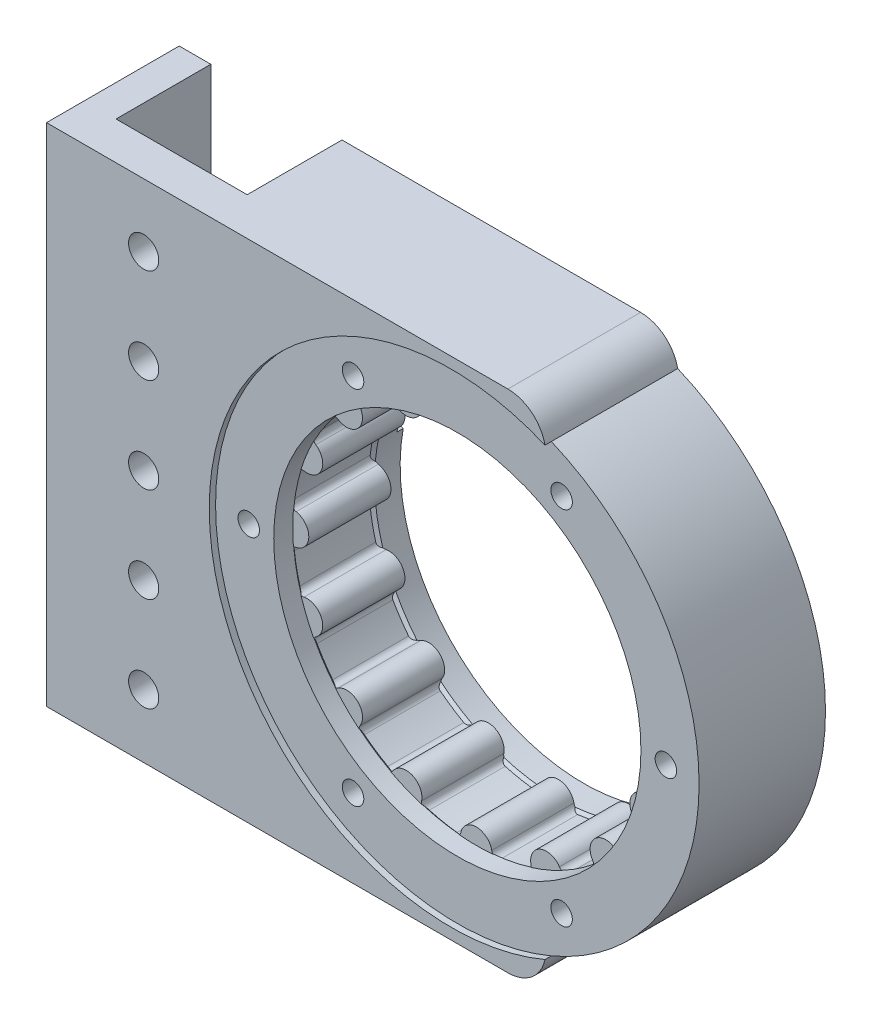
from build123d import *

# Parameters (mm, degrees)
EXTRUDE_START         = -19
EXTRUDE_2_OUTLINE_R   = 35
EXTRUDE_2_OUTLINE_R_2 = 1.7
EXTRUDE_2_DEPTH       = 20
EXTRUDE_START_2       = -16
EXTRUDE_2_2_DEPTH     = 13
EXTRUDE_START_3       = -3.0500001
EXTRUDE_2_3_DEPTH     = 4.0500001
EXTRUDE_2_4_DEPTH     = 3.049996921
EXTRUDE_2_5_DEPTH     = 3.0500001
SKETCH_8_R            = 38.25
SKETCH_8_R_2          = 30
EXTRUDE_3_DEPTH       = 20
EXTRUDE_4_DEPTH       = 21
SKETCH_11_W           = 20.75
SKETCH_11_H           = 80
CUT_EXTRUDE_1_DEPTH   = 15
SKETCH_12_R           = 1.7
CUT_EXTRUDE_2_DEPTH   = 79.339006887
SKETCH_13_R           = 2.387468124
CUT_EXTRUDE_3_DEPTH   = 77.948034413


with BuildPart() as part:
    # 凸台-拉伸2: read off the stored shape, not the designer's step
    # 凸台-拉伸2 outline → 凸台-拉伸2 (new body)
    with BuildSketch(Plane(origin=(0, 0, -24), x_dir=(-1, 0, 0), z_dir=(0, 0, -1)).offset(EXTRUDE_START)):
        Circle(EXTRUDE_2_OUTLINE_R)
        with Locations((-16, -27.712812921)):
            Circle(EXTRUDE_2_OUTLINE_R_2, mode=Mode.SUBTRACT)
        with Locations((-27.712812921, -16)):
            Circle(EXTRUDE_2_OUTLINE_R_2, mode=Mode.SUBTRACT)
        with Locations((0, -32)):
            Circle(EXTRUDE_2_OUTLINE_R_2, mode=Mode.SUBTRACT)
        with Locations((16, -27.712812921)):
            Circle(EXTRUDE_2_OUTLINE_R_2, mode=Mode.SUBTRACT)
        with Locations((27.712812921, -16)):
            Circle(EXTRUDE_2_OUTLINE_R_2, mode=Mode.SUBTRACT)
        with Locations((-32, 0)):
            Circle(EXTRUDE_2_OUTLINE_R_2, mode=Mode.SUBTRACT)
        with Locations((-27.712812921, 16)):
            Circle(EXTRUDE_2_OUTLINE_R_2, mode=Mode.SUBTRACT)
        with BuildLine():
            ThreePointArc((29.28584392, 3.548146824), (29.221419292, 3.056078117), (28.928367046, 2.655575276))
            ThreePointArc((28.928367046, 2.655575276), (29.05, 0), (28.928367046, -2.655575276))
            ThreePointArc((28.928367046, -2.655575276), (29.221419292, -3.056078117), (29.28584392, -3.548146824))
            ThreePointArc((29.28584392, -3.548146824), (28.933165772, -5.7551645), (28.414408795, -7.929147042))
            ThreePointArc((28.414408795, -7.929147042), (28.166581658, -8.35910501), (27.742570884, -8.616975149))
            ThreePointArc((27.742570884, -8.616975149), (26.83870042, -11.11695371), (25.710081562, -13.523838438))
            ThreePointArc((25.710081562, -13.523838438), (25.827560731, -14.006001055), (25.698774785, -14.4852675))
            ThreePointArc((25.698774785, -14.4852675), (24.528353563, -16.389321874), (23.217137509, -18.199300149))
            ThreePointArc((23.217137509, -18.199300149), (22.823637298, -18.501690176), (22.333219792, -18.577669221))
            ThreePointArc((22.333219792, -18.577669221), (20.541451993, -20.541451993), (18.577669221, -22.333219792))
            ThreePointArc((18.577669221, -22.333219792), (18.501690176, -22.823637298), (18.199300149, -23.217137509))
            ThreePointArc((18.199300149, -23.217137509), (16.389321874, -24.528353563), (14.4852675, -25.698774785))
            ThreePointArc((14.4852675, -25.698774785), (14.006001055, -25.827560731), (13.523838438, -25.710081562))
            ThreePointArc((13.523838438, -25.710081562), (11.11695371, -26.83870042), (8.616975149, -27.742570884))
            ThreePointArc((8.616975149, -27.742570884), (8.35910501, -28.166581658), (7.929147042, -28.414408795))
            ThreePointArc((7.929147042, -28.414408795), (5.7551645, -28.933165772), (3.548146824, -29.28584392))
            ThreePointArc((3.548146824, -29.28584392), (3.056078117, -29.221419292), (2.655575276, -28.928367046))
            ThreePointArc((2.655575276, -28.928367046), (0, -29.05), (-2.655575276, -28.928367046))
            ThreePointArc((-2.655575276, -28.928367046), (-3.056078117, -29.221419292), (-3.548146824, -29.28584392))
            ThreePointArc((-3.548146824, -29.28584392), (-5.7551645, -28.933165772), (-7.929147042, -28.414408795))
            ThreePointArc((-7.929147042, -28.414408795), (-8.35910501, -28.166581658), (-8.616975149, -27.742570884))
            ThreePointArc((-8.616975149, -27.742570884), (-11.11695371, -26.83870042), (-13.523838438, -25.710081562))
            ThreePointArc((-13.523838438, -25.710081562), (-14.006001055, -25.827560731), (-14.4852675, -25.698774785))
            ThreePointArc((-14.4852675, -25.698774785), (-16.389321874, -24.528353563), (-18.199300149, -23.217137509))
            ThreePointArc((-18.199300149, -23.217137509), (-18.501690176, -22.823637298), (-18.577669221, -22.333219792))
            ThreePointArc((-18.577669221, -22.333219792), (-20.541451993, -20.541451993), (-22.333219792, -18.577669221))
            ThreePointArc((-22.333219792, -18.577669221), (-22.823637298, -18.501690176), (-23.217137509, -18.199300149))
            ThreePointArc((-23.217137509, -18.199300149), (-24.528353563, -16.389321874), (-25.698774785, -14.4852675))
            ThreePointArc((-25.698774785, -14.4852675), (-25.827560731, -14.006001055), (-25.710081562, -13.523838438))
            ThreePointArc((-25.710081562, -13.523838438), (-26.83870042, -11.11695371), (-27.742570884, -8.616975149))
            ThreePointArc((-27.742570884, -8.616975149), (-28.166581658, -8.35910501), (-28.414408795, -7.929147042))
            ThreePointArc((-28.414408795, -7.929147042), (-28.46389208, -7.749635323), (-28.512241289, -7.569814837))
            ThreePointArc((-28.512241289, -7.569814837), (-29.874875562, -6.387042362), (-29.114993387, -4.750490508))
            ThreePointArc((-29.114993387, -4.750490508), (-29.206606395, -4.150197931), (-29.28584392, -3.548146824))
            ThreePointArc((-29.28584392, -3.548146824), (-29.221419292, -3.056078117), (-28.928367046, -2.655575276))
            ThreePointArc((-28.928367046, -2.655575276), (-29.05, 0), (-28.928367046, 2.655575276))
            ThreePointArc((-28.928367046, 2.655575276), (-29.221419292, 3.056078117), (-29.28584392, 3.548146824))
            ThreePointArc((-29.28584392, 3.548146824), (-28.933165772, 5.7551645), (-28.414408795, 7.929147042))
            ThreePointArc((-28.414408795, 7.929147042), (-28.166581658, 8.35910501), (-27.742570884, 8.616975149))
            ThreePointArc((-27.742570884, 8.616975149), (-26.83870042, 11.11695371), (-25.710081562, 13.523838438))
            ThreePointArc((-25.710081562, 13.523838438), (-25.827560731, 14.006001055), (-25.698774785, 14.4852675))
            ThreePointArc((-25.698774785, 14.4852675), (-24.528353563, 16.389321874), (-23.217137509, 18.199300149))
            ThreePointArc((-23.217137509, 18.199300149), (-22.823637298, 18.501690176), (-22.333219792, 18.577669221))
            ThreePointArc((-22.333219792, 18.577669221), (-20.541451993, 20.541451993), (-18.577669221, 22.333219792))
            ThreePointArc((-18.577669221, 22.333219792), (-18.501690176, 22.823637298), (-18.199300149, 23.217137509))
            ThreePointArc((-18.199300149, 23.217137509), (-16.389321874, 24.528353563), (-14.4852675, 25.698774785))
            ThreePointArc((-14.4852675, 25.698774785), (-14.006001055, 25.827560731), (-13.523838438, 25.710081562))
            ThreePointArc((-13.523838438, 25.710081562), (-11.11695371, 26.83870042), (-8.616975149, 27.742570884))
            ThreePointArc((-8.616975149, 27.742570884), (-8.35910501, 28.166581658), (-7.929147042, 28.414408795))
            ThreePointArc((-7.929147042, 28.414408795), (-5.7551645, 28.933165772), (-3.548146824, 29.28584392))
            ThreePointArc((-3.548146824, 29.28584392), (-3.056078117, 29.221419292), (-2.655575276, 28.928367046))
            ThreePointArc((-2.655575276, 28.928367046), (0, 29.05), (2.655575276, 28.928367046))
            ThreePointArc((2.655575276, 28.928367046), (3.056078117, 29.221419292), (3.548146824, 29.28584392))
            ThreePointArc((3.548146824, 29.28584392), (5.7551645, 28.933165772), (7.929147042, 28.414408795))
            ThreePointArc((7.929147042, 28.414408795), (8.35910501, 28.166581658), (8.616975149, 27.742570884))
            ThreePointArc((8.616975149, 27.742570884), (11.11695371, 26.83870042), (13.523838438, 25.710081562))
            ThreePointArc((13.523838438, 25.710081562), (14.006001055, 25.827560731), (14.4852675, 25.698774785))
            ThreePointArc((14.4852675, 25.698774785), (16.389321874, 24.528353563), (18.199300149, 23.217137509))
            ThreePointArc((18.199300149, 23.217137509), (18.501690176, 22.823637298), (18.577669221, 22.333219792))
            ThreePointArc((18.577669221, 22.333219792), (20.541451993, 20.541451993), (22.333219792, 18.577669221))
            ThreePointArc((22.333219792, 18.577669221), (22.823637298, 18.501690176), (23.217137509, 18.199300149))
            ThreePointArc((23.217137509, 18.199300149), (24.528353563, 16.389321874), (25.698774785, 14.4852675))
            ThreePointArc((25.698774785, 14.4852675), (25.827560731, 14.006001055), (25.710081562, 13.523838438))
            ThreePointArc((25.710081562, 13.523838438), (26.83870042, 11.11695371), (27.742570884, 8.616975149))
            ThreePointArc((27.742570884, 8.616975149), (28.012796563, 8.487779368), (28.232640229, 8.28435314))
            ThreePointArc((28.232640229, 8.28435314), (29.695238585, 7.173826758), (28.986612137, 5.479627432))
            ThreePointArc((28.986612137, 5.479627432), (29.152228698, 4.516366008), (29.28584392, 3.548146824))
        make_face(mode=Mode.SUBTRACT)
        with Locations((-16, 27.712812921)):
            Circle(EXTRUDE_2_OUTLINE_R_2, mode=Mode.SUBTRACT)
        with Locations((32, 0)):
            Circle(EXTRUDE_2_OUTLINE_R_2, mode=Mode.SUBTRACT)
        with Locations((27.712812921, 16)):
            Circle(EXTRUDE_2_OUTLINE_R_2, mode=Mode.SUBTRACT)
        with Locations((0, 32)):
            Circle(EXTRUDE_2_OUTLINE_R_2, mode=Mode.SUBTRACT)
        with Locations((16, 27.712812921)):
            Circle(EXTRUDE_2_OUTLINE_R_2, mode=Mode.SUBTRACT)
    extrude(amount=EXTRUDE_2_DEPTH)

    # Extrude 2 2 outline → Extrude 2 2 (add)
    with BuildSketch(Plane(origin=(0, 0, -24), x_dir=(-1, 0, 0), z_dir=(0, 0, -1)).offset(EXTRUDE_START_2)):
        with BuildLine():
            ThreePointArc((28.928367046, -2.655575276), (29.05, 0), (28.928367046, 2.655575276))
            ThreePointArc((28.928367046, 2.655575276), (28.724337054, 2.52563035), (28.495073892, 2.448479043))
            ThreePointArc((28.495073892, 2.448479043), (26.5, 0), (28.495073892, -2.448479043))
            ThreePointArc((28.495073892, -2.448479043), (28.724337054, -2.52563035), (28.928367046, -2.655575276))
        make_face()
        with BuildLine():
            ThreePointArc((28.414408795, 7.929147042), (28.726631157, 6.710488983), (28.986612137, 5.479627432))
            ThreePointArc((28.986612137, 5.479627432), (29.695238585, 7.173826758), (28.232640229, 8.28435314))
            ThreePointArc((28.232640229, 8.28435314), (28.341420872, 8.115908143), (28.414408795, 7.929147042))
        make_face()
        with BuildLine():
            ThreePointArc((27.26300791, 8.642493009), (27.50434398, 8.658949709), (27.742570884, 8.616975149))
            ThreePointArc((27.742570884, 8.616975149), (26.83870042, 11.11695371), (25.710081562, 13.523838438))
            ThreePointArc((25.710081562, 13.523838438), (25.571310198, 13.325706083), (25.389023182, 13.166692356))
            ThreePointArc((25.389023182, 13.166692356), (24.482807612, 10.141110958), (27.26300791, 8.642493009))
        make_face()
        with BuildLine():
            ThreePointArc((21.880396114, 18.417723844), (22.097063863, 18.525283168), (22.333219792, 18.577669221))
            ThreePointArc((22.333219792, 18.577669221), (20.541451993, 20.541451993), (18.577669221, 22.333219792))
            ThreePointArc((18.577669221, 22.333219792), (18.525283168, 22.097063863), (18.417723844, 21.880396114))
            ThreePointArc((18.417723844, 21.880396114), (18.738329701, 18.738329701), (21.880396114, 18.417723844))
        make_face()
        with BuildLine():
            ThreePointArc((25.710081562, -13.523838438), (26.83870042, -11.11695371), (27.742570884, -8.616975149))
            ThreePointArc((27.742570884, -8.616975149), (27.50434398, -8.658949709), (27.26300791, -8.642493009))
            ThreePointArc((27.26300791, -8.642493009), (24.482807612, -10.141110958), (25.389023182, -13.166692356))
            ThreePointArc((25.389023182, -13.166692356), (25.571310198, -13.325706083), (25.710081562, -13.523838438))
        make_face()
        with BuildLine():
            ThreePointArc((13.166692356, 25.389023182), (13.325706083, 25.571310198), (13.523838438, 25.710081562))
            ThreePointArc((13.523838438, 25.710081562), (11.11695371, 26.83870042), (8.616975149, 27.742570884))
            ThreePointArc((8.616975149, 27.742570884), (8.658949709, 27.50434398), (8.642493009, 27.26300791))
            ThreePointArc((8.642493009, 27.26300791), (10.141110958, 24.482807612), (13.166692356, 25.389023182))
        make_face()
        with BuildLine():
            ThreePointArc((18.577669221, -22.333219792), (20.541451993, -20.541451993), (22.333219792, -18.577669221))
            ThreePointArc((22.333219792, -18.577669221), (22.097063863, -18.525283168), (21.880396114, -18.417723844))
            ThreePointArc((21.880396114, -18.417723844), (18.738329701, -18.738329701), (18.417723844, -21.880396114))
            ThreePointArc((18.417723844, -21.880396114), (18.525283168, -22.097063863), (18.577669221, -22.333219792))
        make_face()
        with BuildLine():
            ThreePointArc((2.448479043, 28.495073892), (2.52563035, 28.724337054), (2.655575276, 28.928367046))
            ThreePointArc((2.655575276, 28.928367046), (0, 29.05), (-2.655575276, 28.928367046))
            ThreePointArc((-2.655575276, 28.928367046), (-2.52563035, 28.724337054), (-2.448479043, 28.495073892))
            ThreePointArc((-2.448479043, 28.495073892), (0, 26.5), (2.448479043, 28.495073892))
        make_face()
        with BuildLine():
            ThreePointArc((8.616975149, -27.742570884), (11.11695371, -26.83870042), (13.523838438, -25.710081562))
            ThreePointArc((13.523838438, -25.710081562), (13.325706083, -25.571310198), (13.166692356, -25.389023182))
            ThreePointArc((13.166692356, -25.389023182), (10.141110958, -24.482807612), (8.642493009, -27.26300791))
            ThreePointArc((8.642493009, -27.26300791), (8.658949709, -27.50434398), (8.616975149, -27.742570884))
        make_face()
        with BuildLine():
            ThreePointArc((-8.642493009, 27.26300791), (-8.658949709, 27.50434398), (-8.616975149, 27.742570884))
            ThreePointArc((-8.616975149, 27.742570884), (-11.11695371, 26.83870042), (-13.523838438, 25.710081562))
            ThreePointArc((-13.523838438, 25.710081562), (-13.325706083, 25.571310198), (-13.166692356, 25.389023182))
            ThreePointArc((-13.166692356, 25.389023182), (-10.141110958, 24.482807612), (-8.642493009, 27.26300791))
        make_face()
        with BuildLine():
            ThreePointArc((-2.655575276, -28.928367046), (0, -29.05), (2.655575276, -28.928367046))
            ThreePointArc((2.655575276, -28.928367046), (2.52563035, -28.724337054), (2.448479043, -28.495073892))
            ThreePointArc((2.448479043, -28.495073892), (0, -26.5), (-2.448479043, -28.495073892))
            ThreePointArc((-2.448479043, -28.495073892), (-2.52563035, -28.724337054), (-2.655575276, -28.928367046))
        make_face()
        with BuildLine():
            ThreePointArc((-18.417723844, 21.880396114), (-18.525283168, 22.097063863), (-18.577669221, 22.333219792))
            ThreePointArc((-18.577669221, 22.333219792), (-20.541451993, 20.541451993), (-22.333219792, 18.577669221))
            ThreePointArc((-22.333219792, 18.577669221), (-22.097063863, 18.525283168), (-21.880396114, 18.417723844))
            ThreePointArc((-21.880396114, 18.417723844), (-18.738329701, 18.738329701), (-18.417723844, 21.880396114))
        make_face()
        with BuildLine():
            ThreePointArc((-13.523838438, -25.710081562), (-11.11695371, -26.83870042), (-8.616975149, -27.742570884))
            ThreePointArc((-8.616975149, -27.742570884), (-8.658949709, -27.50434398), (-8.642493009, -27.26300791))
            ThreePointArc((-8.642493009, -27.26300791), (-10.141110958, -24.482807612), (-13.166692356, -25.389023182))
            ThreePointArc((-13.166692356, -25.389023182), (-13.325706083, -25.571310198), (-13.523838438, -25.710081562))
        make_face()
        with BuildLine():
            ThreePointArc((-25.389023182, 13.166692356), (-25.571310198, 13.325706083), (-25.710081562, 13.523838438))
            ThreePointArc((-25.710081562, 13.523838438), (-26.83870042, 11.11695371), (-27.742570884, 8.616975149))
            ThreePointArc((-27.742570884, 8.616975149), (-27.50434398, 8.658949709), (-27.26300791, 8.642493009))
            ThreePointArc((-27.26300791, 8.642493009), (-24.482807612, 10.141110958), (-25.389023182, 13.166692356))
        make_face()
        with BuildLine():
            ThreePointArc((-22.333219792, -18.577669221), (-20.541451993, -20.541451993), (-18.577669221, -22.333219792))
            ThreePointArc((-18.577669221, -22.333219792), (-18.525283168, -22.097063863), (-18.417723844, -21.880396114))
            ThreePointArc((-18.417723844, -21.880396114), (-18.738329701, -18.738329701), (-21.880396114, -18.417723844))
            ThreePointArc((-21.880396114, -18.417723844), (-22.097063863, -18.525283168), (-22.333219792, -18.577669221))
        make_face()
        with BuildLine():
            ThreePointArc((-28.495073892, 2.448479043), (-28.724337054, 2.52563035), (-28.928367046, 2.655575276))
            ThreePointArc((-28.928367046, 2.655575276), (-29.05, 0), (-28.928367046, -2.655575276))
            ThreePointArc((-28.928367046, -2.655575276), (-28.724337054, -2.52563035), (-28.495073892, -2.448479043))
            ThreePointArc((-28.495073892, -2.448479043), (-26.5, 0), (-28.495073892, 2.448479043))
        make_face()
        with BuildLine():
            ThreePointArc((-27.742570884, -8.616975149), (-26.83870042, -11.11695371), (-25.710081562, -13.523838438))
            ThreePointArc((-25.710081562, -13.523838438), (-25.571310198, -13.325706083), (-25.389023182, -13.166692356))
            ThreePointArc((-25.389023182, -13.166692356), (-24.482807612, -10.141110958), (-27.26300791, -8.642493009))
            ThreePointArc((-27.26300791, -8.642493009), (-27.50434398, -8.658949709), (-27.742570884, -8.616975149))
        make_face()
        with BuildLine():
            ThreePointArc((-28.512241289, -7.569814837), (-28.848079512, -6.167520448), (-29.114993387, -4.750490508))
            ThreePointArc((-29.114993387, -4.750490508), (-29.874875562, -6.387042362), (-28.512241289, -7.569814837))
        make_face()
    extrude(amount=EXTRUDE_2_2_DEPTH)

    # Extrude 2 3 outline → Extrude 2 3 (add)
    with BuildSketch(Plane(origin=(0, 0, -24), x_dir=(-1, 0, 0), z_dir=(0, 0, -1)).offset(EXTRUDE_START_3)):
        with BuildLine():
            ThreePointArc((28.986612137, 5.479627432), (28.779129413, 5.382105224), (28.559208433, 5.317340849))
            ThreePointArc((28.559208433, 5.317340849), (28.774582232, 3.990728931), (28.928367046, 2.655575276))
            ThreePointArc((28.928367046, 2.655575276), (29.221419292, 3.056078117), (29.28584392, 3.548146824))
            ThreePointArc((29.28584392, 3.548146824), (29.152228698, 4.516366008), (28.986612137, 5.479627432))
        make_face()
        with BuildLine():
            ThreePointArc((27.742570884, 8.616975149), (27.801353712, 8.425392086), (27.858813533, 8.233408076))
            ThreePointArc((27.858813533, 8.233408076), (28.044118775, 8.270680628), (28.232640229, 8.28435314))
            ThreePointArc((28.232640229, 8.28435314), (28.012796563, 8.487779368), (27.742570884, 8.616975149))
        make_face()
        with BuildLine():
            ThreePointArc((22.333219792, 18.577669221), (24.154192237, 16.139315269), (25.710081562, 13.523838438))
            ThreePointArc((25.710081562, 13.523838438), (25.827560731, 14.006001055), (25.698774785, 14.4852675))
            ThreePointArc((25.698774785, 14.4852675), (24.528353563, 16.389321874), (23.217137509, 18.199300149))
            ThreePointArc((23.217137509, 18.199300149), (22.823637298, 18.501690176), (22.333219792, 18.577669221))
        make_face()
        with BuildLine():
            ThreePointArc((29.28584392, -3.548146824), (29.221419292, -3.056078117), (28.928367046, -2.655575276))
            ThreePointArc((28.928367046, -2.655575276), (28.491812396, -5.667373854), (27.742570884, -8.616975149))
            ThreePointArc((27.742570884, -8.616975149), (28.166581658, -8.35910501), (28.414408795, -7.929147042))
            ThreePointArc((28.414408795, -7.929147042), (28.933165772, -5.7551645), (29.28584392, -3.548146824))
        make_face()
        with BuildLine():
            ThreePointArc((13.523838438, 25.710081562), (16.139315269, 24.154192237), (18.577669221, 22.333219792))
            ThreePointArc((18.577669221, 22.333219792), (18.501690176, 22.823637298), (18.199300149, 23.217137509))
            ThreePointArc((18.199300149, 23.217137509), (16.389321874, 24.528353563), (14.4852675, 25.698774785))
            ThreePointArc((14.4852675, 25.698774785), (14.006001055, 25.827560731), (13.523838438, 25.710081562))
        make_face()
        with BuildLine():
            ThreePointArc((25.698774785, -14.4852675), (25.827560731, -14.006001055), (25.710081562, -13.523838438))
            ThreePointArc((25.710081562, -13.523838438), (24.154192237, -16.139315269), (22.333219792, -18.577669221))
            ThreePointArc((22.333219792, -18.577669221), (22.823637298, -18.501690176), (23.217137509, -18.199300149))
            ThreePointArc((23.217137509, -18.199300149), (24.528353563, -16.389321874), (25.698774785, -14.4852675))
        make_face()
        with BuildLine():
            ThreePointArc((2.655575276, 28.928367046), (5.667373854, 28.491812396), (8.616975149, 27.742570884))
            ThreePointArc((8.616975149, 27.742570884), (8.35910501, 28.166581658), (7.929147042, 28.414408795))
            ThreePointArc((7.929147042, 28.414408795), (5.7551645, 28.933165772), (3.548146824, 29.28584392))
            ThreePointArc((3.548146824, 29.28584392), (3.056078117, 29.221419292), (2.655575276, 28.928367046))
        make_face()
        with BuildLine():
            ThreePointArc((18.199300149, -23.217137509), (18.501690176, -22.823637298), (18.577669221, -22.333219792))
            ThreePointArc((18.577669221, -22.333219792), (16.139315269, -24.154192237), (13.523838438, -25.710081562))
            ThreePointArc((13.523838438, -25.710081562), (14.006001055, -25.827560731), (14.4852675, -25.698774785))
            ThreePointArc((14.4852675, -25.698774785), (16.389321874, -24.528353563), (18.199300149, -23.217137509))
        make_face()
        with BuildLine():
            ThreePointArc((-8.616975149, 27.742570884), (-5.667373854, 28.491812396), (-2.655575276, 28.928367046))
            ThreePointArc((-2.655575276, 28.928367046), (-3.056078117, 29.221419292), (-3.548146824, 29.28584392))
            ThreePointArc((-3.548146824, 29.28584392), (-5.7551645, 28.933165772), (-7.929147042, 28.414408795))
            ThreePointArc((-7.929147042, 28.414408795), (-8.35910501, 28.166581658), (-8.616975149, 27.742570884))
        make_face()
        with BuildLine():
            ThreePointArc((7.929147042, -28.414408795), (8.35910501, -28.166581658), (8.616975149, -27.742570884))
            ThreePointArc((8.616975149, -27.742570884), (5.667373854, -28.491812396), (2.655575276, -28.928367046))
            ThreePointArc((2.655575276, -28.928367046), (3.056078117, -29.221419292), (3.548146824, -29.28584392))
            ThreePointArc((3.548146824, -29.28584392), (5.7551645, -28.933165772), (7.929147042, -28.414408795))
        make_face()
        with BuildLine():
            ThreePointArc((-18.577669221, 22.333219792), (-16.139315269, 24.154192237), (-13.523838438, 25.710081562))
            ThreePointArc((-13.523838438, 25.710081562), (-14.006001055, 25.827560731), (-14.4852675, 25.698774785))
            ThreePointArc((-14.4852675, 25.698774785), (-16.389321874, 24.528353563), (-18.199300149, 23.217137509))
            ThreePointArc((-18.199300149, 23.217137509), (-18.501690176, 22.823637298), (-18.577669221, 22.333219792))
        make_face()
        with BuildLine():
            ThreePointArc((-3.548146824, -29.28584392), (-3.056078117, -29.221419292), (-2.655575276, -28.928367046))
            ThreePointArc((-2.655575276, -28.928367046), (-5.667373854, -28.491812396), (-8.616975149, -27.742570884))
            ThreePointArc((-8.616975149, -27.742570884), (-8.35910501, -28.166581658), (-7.929147042, -28.414408795))
            ThreePointArc((-7.929147042, -28.414408795), (-5.7551645, -28.933165772), (-3.548146824, -29.28584392))
        make_face()
        with BuildLine():
            ThreePointArc((-25.710081562, 13.523838438), (-24.154192237, 16.139315269), (-22.333219792, 18.577669221))
            ThreePointArc((-22.333219792, 18.577669221), (-22.823637298, 18.501690176), (-23.217137509, 18.199300149))
            ThreePointArc((-23.217137509, 18.199300149), (-24.528353563, 16.389321874), (-25.698774785, 14.4852675))
            ThreePointArc((-25.698774785, 14.4852675), (-25.827560731, 14.006001055), (-25.710081562, 13.523838438))
        make_face()
        with BuildLine():
            ThreePointArc((-14.4852675, -25.698774785), (-14.006001055, -25.827560731), (-13.523838438, -25.710081562))
            ThreePointArc((-13.523838438, -25.710081562), (-16.139315269, -24.154192237), (-18.577669221, -22.333219792))
            ThreePointArc((-18.577669221, -22.333219792), (-18.501690176, -22.823637298), (-18.199300149, -23.217137509))
            ThreePointArc((-18.199300149, -23.217137509), (-16.389321874, -24.528353563), (-14.4852675, -25.698774785))
        make_face()
        with BuildLine():
            ThreePointArc((-28.928367046, 2.655575276), (-28.491812396, 5.667373854), (-27.742570884, 8.616975149))
            ThreePointArc((-27.742570884, 8.616975149), (-28.166581658, 8.35910501), (-28.414408795, 7.929147042))
            ThreePointArc((-28.414408795, 7.929147042), (-28.933165772, 5.7551645), (-29.28584392, 3.548146824))
            ThreePointArc((-29.28584392, 3.548146824), (-29.221419292, 3.056078117), (-28.928367046, 2.655575276))
        make_face()
        with BuildLine():
            ThreePointArc((-23.217137509, -18.199300149), (-22.823637298, -18.501690176), (-22.333219792, -18.577669221))
            ThreePointArc((-22.333219792, -18.577669221), (-24.154192237, -16.139315269), (-25.710081562, -13.523838438))
            ThreePointArc((-25.710081562, -13.523838438), (-25.827560731, -14.006001055), (-25.698774785, -14.4852675))
            ThreePointArc((-25.698774785, -14.4852675), (-24.528353563, -16.389321874), (-23.217137509, -18.199300149))
        make_face()
        with BuildLine():
            ThreePointArc((-28.683651743, -4.598980614), (-28.822393782, -3.629341081), (-28.928367046, -2.655575276))
            ThreePointArc((-28.928367046, -2.655575276), (-29.221419292, -3.056078117), (-29.28584392, -3.548146824))
            ThreePointArc((-29.28584392, -3.548146824), (-29.206606395, -4.150197931), (-29.114993387, -4.750490508))
            ThreePointArc((-29.114993387, -4.750490508), (-28.90512871, -4.658205735), (-28.683651743, -4.598980614))
        make_face()
        with BuildLine():
            ThreePointArc((-28.414408795, -7.929147042), (-28.166581658, -8.35910501), (-27.742570884, -8.616975149))
            ThreePointArc((-27.742570884, -8.616975149), (-27.904889611, -8.075867494), (-28.056655339, -7.531705728))
            ThreePointArc((-28.056655339, -7.531705728), (-28.282987901, -7.568219196), (-28.512241289, -7.569814837))
            ThreePointArc((-28.512241289, -7.569814837), (-28.46389208, -7.749635323), (-28.414408795, -7.929147042))
        make_face()
    extrude(amount=EXTRUDE_2_3_DEPTH)

    # Extrude 2 4 outline → Extrude 2 4 (add)
    with BuildSketch(Plane(origin=(0, 0, -24), x_dir=(-1, 0, 0), z_dir=(0, 0, -1)).offset(EXTRUDE_START)):
        with BuildLine():
            ThreePointArc((29.28584392, 3.548146824), (29.152228698, 4.516366008), (28.986612137, 5.479627432))
            ThreePointArc((28.986612137, 5.479627432), (29.695238585, 7.173826758), (28.232640229, 8.28435314))
            ThreePointArc((28.232640229, 8.28435314), (28.012796563, 8.487779368), (27.742570884, 8.616975149))
            ThreePointArc((27.742570884, 8.616975149), (28.491812396, 5.667373854), (28.928367046, 2.655575276))
            ThreePointArc((28.928367046, 2.655575276), (29.221419292, 3.056078117), (29.28584392, 3.548146824))
        make_face()
        with BuildLine():
            ThreePointArc((22.333219792, 18.577669221), (24.154192237, 16.139315269), (25.710081562, 13.523838438))
            ThreePointArc((25.710081562, 13.523838438), (25.827560731, 14.006001055), (25.698774785, 14.4852675))
            ThreePointArc((25.698774785, 14.4852675), (24.528353563, 16.389321874), (23.217137509, 18.199300149))
            ThreePointArc((23.217137509, 18.199300149), (22.823637298, 18.501690176), (22.333219792, 18.577669221))
        make_face()
        with BuildLine():
            ThreePointArc((29.28584392, -3.548146824), (29.221419292, -3.056078117), (28.928367046, -2.655575276))
            ThreePointArc((28.928367046, -2.655575276), (28.491812396, -5.667373854), (27.742570884, -8.616975149))
            ThreePointArc((27.742570884, -8.616975149), (28.166581658, -8.35910501), (28.414408795, -7.929147042))
            ThreePointArc((28.414408795, -7.929147042), (28.933165772, -5.7551645), (29.28584392, -3.548146824))
        make_face()
        with BuildLine():
            ThreePointArc((13.523838438, 25.710081562), (16.139315269, 24.154192237), (18.577669221, 22.333219792))
            ThreePointArc((18.577669221, 22.333219792), (18.501690176, 22.823637298), (18.199300149, 23.217137509))
            ThreePointArc((18.199300149, 23.217137509), (16.389321874, 24.528353563), (14.4852675, 25.698774785))
            ThreePointArc((14.4852675, 25.698774785), (14.006001055, 25.827560731), (13.523838438, 25.710081562))
        make_face()
        with BuildLine():
            ThreePointArc((25.698774785, -14.4852675), (25.827560731, -14.006001055), (25.710081562, -13.523838438))
            ThreePointArc((25.710081562, -13.523838438), (24.154192237, -16.139315269), (22.333219792, -18.577669221))
            ThreePointArc((22.333219792, -18.577669221), (22.823637298, -18.501690176), (23.217137509, -18.199300149))
            ThreePointArc((23.217137509, -18.199300149), (24.528353563, -16.389321874), (25.698774785, -14.4852675))
        make_face()
        with BuildLine():
            ThreePointArc((2.655575276, 28.928367046), (5.667373854, 28.491812396), (8.616975149, 27.742570884))
            ThreePointArc((8.616975149, 27.742570884), (8.35910501, 28.166581658), (7.929147042, 28.414408795))
            ThreePointArc((7.929147042, 28.414408795), (5.7551645, 28.933165772), (3.548146824, 29.28584392))
            ThreePointArc((3.548146824, 29.28584392), (3.056078117, 29.221419292), (2.655575276, 28.928367046))
        make_face()
        with BuildLine():
            ThreePointArc((18.199300149, -23.217137509), (18.501690176, -22.823637298), (18.577669221, -22.333219792))
            ThreePointArc((18.577669221, -22.333219792), (16.139315269, -24.154192237), (13.523838438, -25.710081562))
            ThreePointArc((13.523838438, -25.710081562), (14.006001055, -25.827560731), (14.4852675, -25.698774785))
            ThreePointArc((14.4852675, -25.698774785), (16.389321874, -24.528353563), (18.199300149, -23.217137509))
        make_face()
        with BuildLine():
            ThreePointArc((-8.616975149, 27.742570884), (-5.667373854, 28.491812396), (-2.655575276, 28.928367046))
            ThreePointArc((-2.655575276, 28.928367046), (-3.056078117, 29.221419292), (-3.548146824, 29.28584392))
            ThreePointArc((-3.548146824, 29.28584392), (-5.7551645, 28.933165772), (-7.929147042, 28.414408795))
            ThreePointArc((-7.929147042, 28.414408795), (-8.35910501, 28.166581658), (-8.616975149, 27.742570884))
        make_face()
        with BuildLine():
            ThreePointArc((7.929147042, -28.414408795), (8.35910501, -28.166581658), (8.616975149, -27.742570884))
            ThreePointArc((8.616975149, -27.742570884), (5.667373854, -28.491812396), (2.655575276, -28.928367046))
            ThreePointArc((2.655575276, -28.928367046), (3.056078117, -29.221419292), (3.548146824, -29.28584392))
            ThreePointArc((3.548146824, -29.28584392), (5.7551645, -28.933165772), (7.929147042, -28.414408795))
        make_face()
        with BuildLine():
            ThreePointArc((-18.577669221, 22.333219792), (-16.139315269, 24.154192237), (-13.523838438, 25.710081562))
            ThreePointArc((-13.523838438, 25.710081562), (-14.006001055, 25.827560731), (-14.4852675, 25.698774785))
            ThreePointArc((-14.4852675, 25.698774785), (-16.389321874, 24.528353563), (-18.199300149, 23.217137509))
            ThreePointArc((-18.199300149, 23.217137509), (-18.501690176, 22.823637298), (-18.577669221, 22.333219792))
        make_face()
        with BuildLine():
            ThreePointArc((-3.548146824, -29.28584392), (-3.056078117, -29.221419292), (-2.655575276, -28.928367046))
            ThreePointArc((-2.655575276, -28.928367046), (-5.667373854, -28.491812396), (-8.616975149, -27.742570884))
            ThreePointArc((-8.616975149, -27.742570884), (-8.35910501, -28.166581658), (-7.929147042, -28.414408795))
            ThreePointArc((-7.929147042, -28.414408795), (-5.7551645, -28.933165772), (-3.548146824, -29.28584392))
        make_face()
        with BuildLine():
            ThreePointArc((-25.710081562, 13.523838438), (-24.154192237, 16.139315269), (-22.333219792, 18.577669221))
            ThreePointArc((-22.333219792, 18.577669221), (-22.823637298, 18.501690176), (-23.217137509, 18.199300149))
            ThreePointArc((-23.217137509, 18.199300149), (-24.528353563, 16.389321874), (-25.698774785, 14.4852675))
            ThreePointArc((-25.698774785, 14.4852675), (-25.827560731, 14.006001055), (-25.710081562, 13.523838438))
        make_face()
        with BuildLine():
            ThreePointArc((-14.4852675, -25.698774785), (-14.006001055, -25.827560731), (-13.523838438, -25.710081562))
            ThreePointArc((-13.523838438, -25.710081562), (-16.139315269, -24.154192237), (-18.577669221, -22.333219792))
            ThreePointArc((-18.577669221, -22.333219792), (-18.501690176, -22.823637298), (-18.199300149, -23.217137509))
            ThreePointArc((-18.199300149, -23.217137509), (-16.389321874, -24.528353563), (-14.4852675, -25.698774785))
        make_face()
        with BuildLine():
            ThreePointArc((-28.928367046, 2.655575276), (-28.491812396, 5.667373854), (-27.742570884, 8.616975149))
            ThreePointArc((-27.742570884, 8.616975149), (-28.166581658, 8.35910501), (-28.414408795, 7.929147042))
            ThreePointArc((-28.414408795, 7.929147042), (-28.933165772, 5.7551645), (-29.28584392, 3.548146824))
            ThreePointArc((-29.28584392, 3.548146824), (-29.221419292, 3.056078117), (-28.928367046, 2.655575276))
        make_face()
        with BuildLine():
            ThreePointArc((-23.217137509, -18.199300149), (-22.823637298, -18.501690176), (-22.333219792, -18.577669221))
            ThreePointArc((-22.333219792, -18.577669221), (-24.154192237, -16.139315269), (-25.710081562, -13.523838438))
            ThreePointArc((-25.710081562, -13.523838438), (-25.827560731, -14.006001055), (-25.698774785, -14.4852675))
            ThreePointArc((-25.698774785, -14.4852675), (-24.528353563, -16.389321874), (-23.217137509, -18.199300149))
        make_face()
        with BuildLine():
            ThreePointArc((-28.928367046, -2.655575276), (-29.221419292, -3.056078117), (-29.28584392, -3.548146824))
            ThreePointArc((-29.28584392, -3.548146824), (-29.206606395, -4.150197931), (-29.114993387, -4.750490508))
            ThreePointArc((-29.114993387, -4.750490508), (-29.874875562, -6.387042362), (-28.512241289, -7.569814837))
            ThreePointArc((-28.512241289, -7.569814837), (-28.46389208, -7.749635323), (-28.414408795, -7.929147042))
            ThreePointArc((-28.414408795, -7.929147042), (-28.166581658, -8.35910501), (-27.742570884, -8.616975149))
            ThreePointArc((-27.742570884, -8.616975149), (-28.491812396, -5.667373854), (-28.928367046, -2.655575276))
        make_face()
    extrude(amount=EXTRUDE_2_4_DEPTH)

    # Extrude 2 5 outline → Extrude 2 5 (add)
    with BuildSketch(Plane(origin=(0, 0, -24), x_dir=(-1, 0, 0), z_dir=(0, 0, -1)).offset(EXTRUDE_START_3)):
        with BuildLine():
            ThreePointArc((27.858813533, 8.233408076), (28.246666399, 6.784418719), (28.559208433, 5.317340849))
            ThreePointArc((28.559208433, 5.317340849), (29.705186178, 7.134732939), (27.858813533, 8.233408076))
        make_face()
        with BuildLine():
            ThreePointArc((-28.056655339, -7.531705728), (-28.408024062, -6.073439627), (-28.683651743, -4.598980614))
            ThreePointArc((-28.683651743, -4.598980614), (-29.874875562, -6.387042362), (-28.056655339, -7.531705728))
        make_face()
    extrude(amount=EXTRUDE_2_5_DEPTH)

    # Extrude 2 6 outline → Extrude 2 6 (revolve)
    with BuildSketch(Plane.XZ):
        Polygon((29.5, -8.049996921), (29.05, -8.049996921), (29.50000105, -8.50000105), align=None)
        Polygon((29.50000105, -20.950005662), (29.50000105, -20.49999895), (29.049994338, -20.950005662), align=None)
    revolve(axis=Axis((0, 0, 0), (0, 0, 1)))

    # 草图8 → 凸台-拉伸3 (add)
    with BuildSketch(Plane(origin=(0, 0, -25), x_dir=(-1, 0, 0), z_dir=(0, 0, -1))):
        Circle(SKETCH_8_R)
        Circle(SKETCH_8_R_2, mode=Mode.SUBTRACT)
    extrude(amount=-EXTRUDE_3_DEPTH)

    # 草图10 → 凸台-拉伸4 (add)
    with BuildSketch(Plane(origin=(0, 0, -25), x_dir=(-1, 0, 0), z_dir=(0, 0, -1))):
        with BuildLine():
            ThreePointArc((38.25, 0), (27.04683438, -27.04683438), (0, -38.25))
            Line((0, -38.25), (0, -40))
            Line((0, -40), (64, -40))
            Line((64, -40), (64, 40))
            Line((64, 40), (0, 40))
            Line((0, 40), (-9, 40))
            ThreePointArc((-9, 40), (-12.778430717, 38.660843413), (-14.870224639, 35.241153772))
            ThreePointArc((-14.870224639, 35.241153772), (21.145642666, 31.87356736), (38.25, 0))
        make_face()
        with BuildLine():
            Line((0, -40), (0, -38.25))
            ThreePointArc((0, -38.25), (-7.585788299, -37.490242943), (-14.870224639, -35.241153772))
            ThreePointArc((-14.870224639, -35.241153772), (-12.778430717, -38.660843413), (-9, -40))
            Line((-9, -40), (0, -40))
        make_face()
    extrude(amount=-EXTRUDE_4_DEPTH)

    # 草图11 → 切除-拉伸1 (cut)
    with BuildSketch(Plane(origin=(0, 0, -25), x_dir=(-1, 0, 0), z_dir=(0, 0, -1))):
        with Locations((48.625, 0)):
            Rectangle(SKETCH_11_W, SKETCH_11_H)
    extrude(amount=-CUT_EXTRUDE_1_DEPTH, mode=Mode.SUBTRACT)

    # 草图12 → 切除-拉伸2 (cut, through all)
    with BuildSketch(Plane(origin=(0, 0, -25), x_dir=(-1, 0, 0), z_dir=(0, 0, -1))):
        with Locations((-33, 0)):
            Circle(SKETCH_12_R)
        with Locations((-16.5, 28.578838325)):
            Circle(SKETCH_12_R)
        with Locations((16.5, 28.578838325)):
            Circle(SKETCH_12_R)
        with Locations((33, 0)):
            Circle(SKETCH_12_R)
        with Locations((16.5, -28.578838325)):
            Circle(SKETCH_12_R)
        with Locations((-16.5, -28.578838325)):
            Circle(SKETCH_12_R)
    extrude(amount=-CUT_EXTRUDE_2_DEPTH, mode=Mode.SUBTRACT)

    # 草图13 → 切除-拉伸3 (cut, through all)
    with BuildSketch(Plane(origin=(0, 0, -10), x_dir=(-1, 0, 0), z_dir=(0, 0, -1))):
        with Locations((48.625, 30)):
            Circle(SKETCH_13_R)
        with Locations((48.625, 15)):
            Circle(SKETCH_13_R)
        with Locations((48.625, 0)):
            Circle(SKETCH_13_R)
        with Locations((48.625, -15)):
            Circle(SKETCH_13_R)
        with Locations((48.625, -30)):
            Circle(SKETCH_13_R)
    extrude(amount=-CUT_EXTRUDE_3_DEPTH, mode=Mode.SUBTRACT)


solid = part.part
